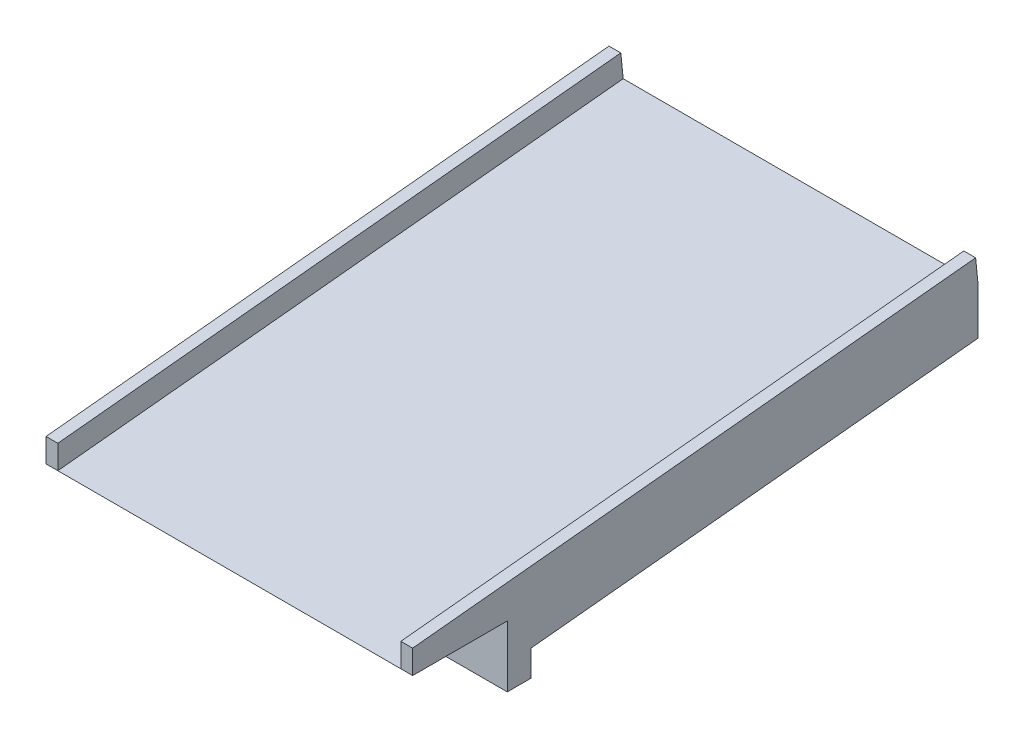
from build123d import *

# Parameters (mm, degrees)
BOSS_EXTRUDE1_DEPTH = 155
SKETCH7_W           = 155
SKETCH7_H           = 20
BOSS_EXTRUDE4_DEPTH = 10
SKETCH8_W           = 5
SKETCH8_H           = 240.20151261
BOSS_EXTRUDE5_DEPTH = 10
CUT_EXTRUDE1_DEPTH  = 258.138075651


with BuildPart() as part:
    # Sketch4 → Boss-Extrude1 (new body)
    with BuildSketch(Plane(origin=(0, 0, 0), x_dir=(0, 0, -1), z_dir=(1, 0, 0))):
        Polygon((0, 15.979848739), (0, 0), (198.997487421, 20), (198.997487421, 40), (-40, 15.979848739), align=None)
    extrude(amount=BOSS_EXTRUDE1_DEPTH)

    # Sketch7 → Boss-Extrude4 (add)
    with BuildSketch(Plane.XY):
        with Locations((77.5, 0)):
            Rectangle(SKETCH7_W, SKETCH7_H)
    extrude(amount=-BOSS_EXTRUDE4_DEPTH)

    # Sketch8 → Boss-Extrude5 (add)
    with BuildSketch(Plane(origin=(0, 19.8, 1.989974874), x_dir=(1, 0, 0), z_dir=(0, 0.99498743710662, 0.10000000000000005))):
        with Locations((2.5, 81.899243695)):
            Rectangle(SKETCH8_W, SKETCH8_H)
        with Locations((152.5, 81.899243695)):
            Rectangle(SKETCH8_W, SKETCH8_H)
    extrude(amount=BOSS_EXTRUDE5_DEPTH)

    # Sketch9 → Cut-Extrude1 (cut, through all)
    with BuildSketch(Plane(origin=(155, 0, 0), x_dir=(0, 0, -1), z_dir=(1, 0, 0))):
        Polygon((-40, 15.979848739), (-40, 26.030226892), (-41, 25.92972311), align=None)
    extrude(amount=-CUT_EXTRUDE1_DEPTH, mode=Mode.SUBTRACT)


solid = part.part
